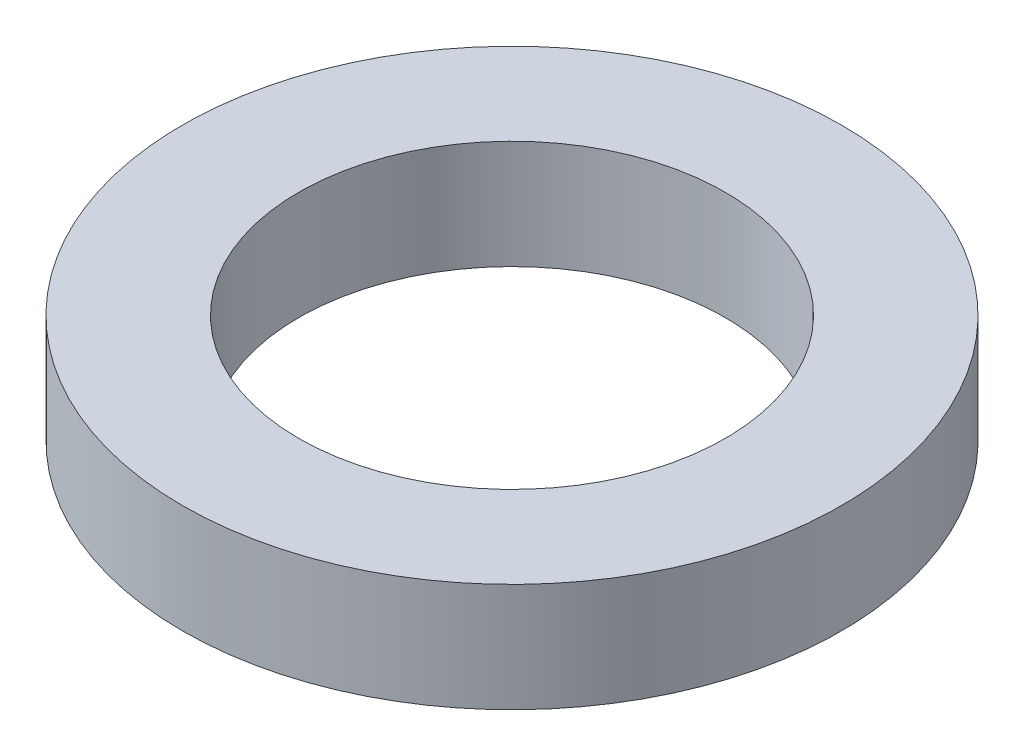
from build123d import *

# Parameters (mm, degrees)
SKETCH1_R           = 42.5
BOSS_EXTRUDE1_DEPTH = 14
SKETCH2_R           = 27.5
CUT_EXTRUDE1_DEPTH  = 62.713045622


with BuildPart() as part:
    # Sketch1 → Boss-Extrude1 (new body)
    with BuildSketch(Plane(origin=(0, 0, 0), x_dir=(1, 0, 0), z_dir=(0, 1, 0))):
        Circle(SKETCH1_R)
    extrude(amount=BOSS_EXTRUDE1_DEPTH)

    # Sketch2 → Cut-Extrude1 (cut, through all)
    with BuildSketch(Plane(origin=(0, 0, 0), x_dir=(1, 0, 0), z_dir=(0, 1, 0))):
        Circle(SKETCH2_R)
    extrude(amount=CUT_EXTRUDE1_DEPTH, mode=Mode.SUBTRACT)


solid = part.part
